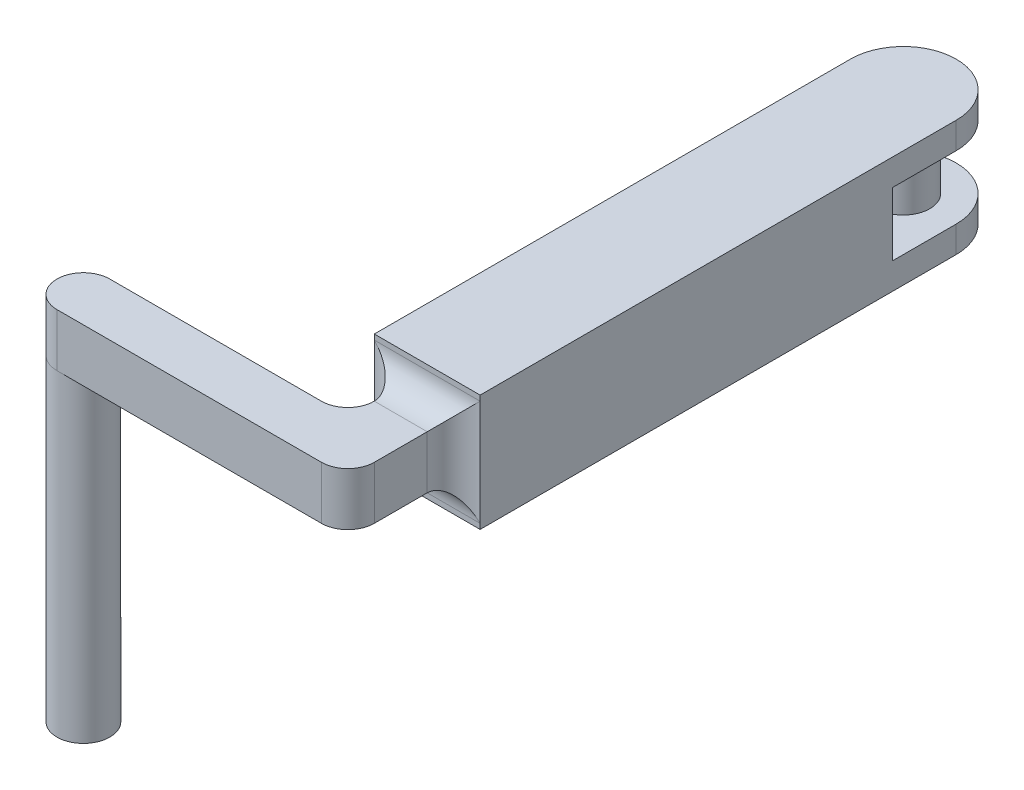
from build123d import *

# Parameters (mm, degrees)
SKETCH1_R                = 3.175
BOSS_EXTRUDE1_DEPTH      = 38.1
BOSS_EXTRUDE2_DEPTH      = 6.35
FILLET1_R                = 3.175
BOSS_EXTRUDE3_DEPTH      = 3.81
BOSS_EXTRUDE3_DEPTH_BACK = 10.16
SKETCH3_W                = 12.7
SKETCH3_H                = 63.5
FILLET2_R                = 3.175
FILLET3_R                = 6.35
CUT_EXTRUDE1_REACH       = 94.13
SKETCH4_W                = 15.24
SKETCH4_H                = 7.62
SKETCH5_R                = 3.175
BOSS_EXTRUDE4_DEPTH      = 10.16


with BuildPart() as part:
    # Sketch1 → Boss-Extrude1 (new body)
    with BuildSketch(Plane(origin=(0, 0, 0), x_dir=(1, 0, 0), z_dir=(0, 1, 0))):
        with Locations(Location((0, 0, 0), (0, 0, 270))):
            Circle(SKETCH1_R)
    extrude(amount=-BOSS_EXTRUDE1_DEPTH)

    # Sketch2 → Boss-Extrude2 (add)
    with BuildSketch(Plane(origin=(0, 0, 0), x_dir=(1, 0, 0), z_dir=(0, 1, 0))):
        Polygon((34.925, -3.175), (-3.175, -3.175), (-3.175, 3.175), (28.575, 3.175), (28.575, 60.325), (34.925, 60.325), align=None)
    extrude(amount=BOSS_EXTRUDE2_DEPTH)

    # Fillet1
    fillet1_edges = [part.edges().sort_by_distance(p)[0] for p in [
        (28.575, 3.175, -3.175),
        (34.925, 3.175, 3.175),
        (-3.175, 3.175, -3.175),
        (-3.175, 3.175, 3.175),
    ]]
    fillet(fillet1_edges, radius=FILLET1_R - 0.0001)  # a hair under: the kernel refuses the full size

    # Sketch3 → Boss-Extrude3 (add, two sides: drawn at the far end of the back side and taken through both)
    with BuildSketch(Plane(origin=(0, 6.35, 0), x_dir=(1, 0, 0), z_dir=(0, 1, 0)).offset(-BOSS_EXTRUDE3_DEPTH_BACK)):
        with Locations((31.75, 41.275)):
            Rectangle(SKETCH3_W, SKETCH3_H)
    extrude(amount=BOSS_EXTRUDE3_DEPTH + BOSS_EXTRUDE3_DEPTH_BACK)

    # Fillet2
    fillet2_edges = [part.edges().sort_by_distance(p)[0] for p in [
        (28.575, 3.175, -9.525),
        (31.75, 0, -9.525),
        (34.925, 3.175, -9.525),
        (31.75, 6.35, -9.525),
    ]]
    fillet(fillet2_edges, radius=FILLET2_R - 0.0001)  # a hair under: the kernel refuses the full size

    # Fillet3
    fillet3_edges = [part.edges().sort_by_distance(p)[0] for p in [
        (25.4, 3.175, -73.025),
        (38.1, 3.175, -73.025),
    ]]
    fillet(fillet3_edges, radius=FILLET3_R - 0.0001)  # a hair under: the kernel refuses the full size

    # Sketch4 → Cut-Extrude1 (cut, up to next)
    with BuildSketch(Plane(origin=(38.1, 0, 0), x_dir=(0, 0, -1), z_dir=(1, 0, 0)), mode=Mode.PRIVATE) as cut_extrude1_sk1:
        with Locations((66.675, 3.175)):
            Rectangle(SKETCH4_W, SKETCH4_H)
    cut_extrude1_tool1 = extrude(cut_extrude1_sk1.sketch, amount=-CUT_EXTRUDE1_REACH, mode=Mode.PRIVATE) & part.part
    add(cut_extrude1_tool1.solids().sort_by_distance((38.1, 3.175, -66.675))[0], mode=Mode.SUBTRACT)

    # Sketch5 → Boss-Extrude4 (add)
    with BuildSketch(Plane(origin=(0, -0.635, 0), x_dir=(1, 0, 0), z_dir=(0, 1, 0))):
        with Locations(Location((31.75, 66.675, 0), (0, 0, 90))):
            Circle(SKETCH5_R)
    extrude(amount=BOSS_EXTRUDE4_DEPTH)


solid = part.part
